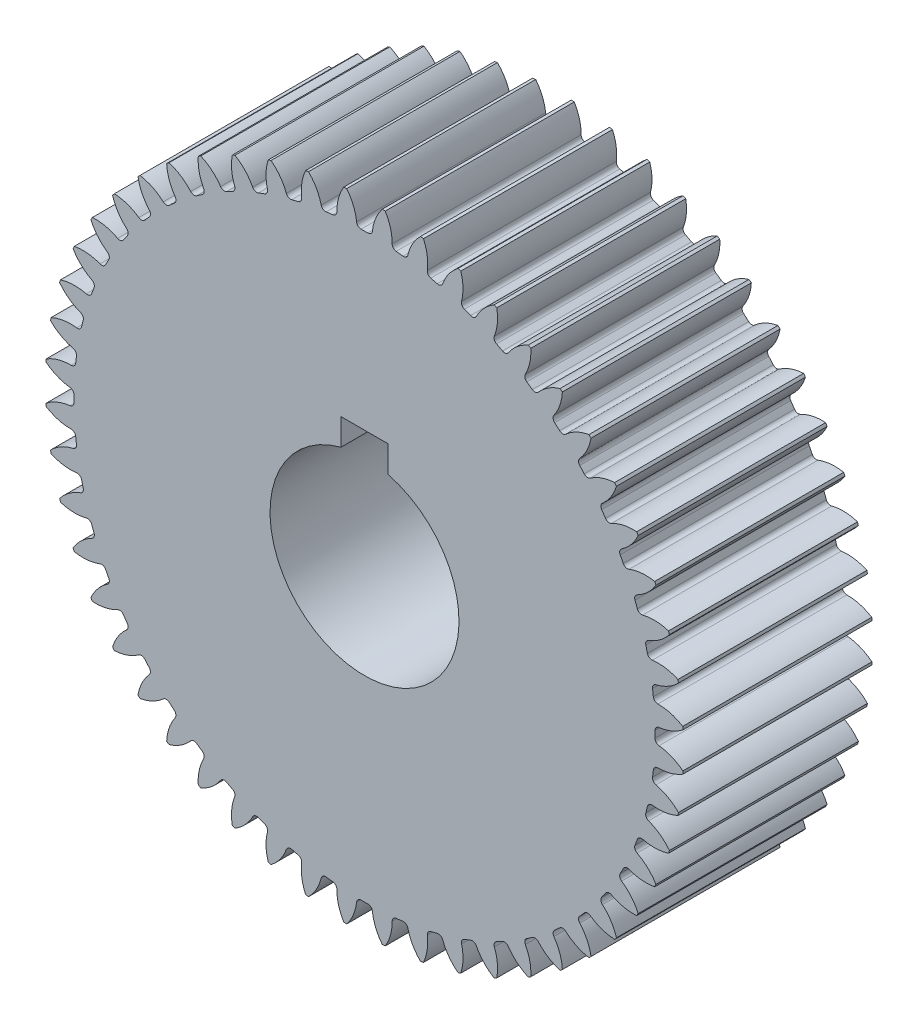
from build123d import *

# Parameters (mm, degrees)
SKETCH1_R                = 33.75
SKETCH1_R_2              = 10
BOSS_EXTRUDE2_DEPTH      = 20
CUT_EXTRUDE1_DEPTH       = 52.750603861
FILLET1_R                = 0.475
CIRPATTERN1_COUNT        = 52
FILLET1_OF_CIRPATTERN1_R = 0.475
CUT_EXTRUDE2_DEPTH       = 52.682144843


with BuildPart() as part:
    # Sketch1 → Boss-Extrude2 (new body)
    with BuildSketch(Plane(origin=(0, 0, 0), x_dir=(0, 1, 0), z_dir=(0, 0, 1))):
        Circle(SKETCH1_R)
        Circle(SKETCH1_R_2, mode=Mode.SUBTRACT)
    extrude(amount=BOSS_EXTRUDE2_DEPTH)

    # Sketch2 → Cut-Extrude1 (cut, through all)
    with BuildSketch(Plane.XY.offset(20)):
        with BuildLine():
            ThreePointArc((-0.804970601, 30.739461972), (-1.102417477, 32.306155708), (-1.881611272, 33.697507905))
            ThreePointArc((-1.881611272, 33.697507905), (0, 33.75), (1.881611272, 33.697507905))
            ThreePointArc((1.881611272, 33.697507905), (1.102417477, 32.306155708), (0.804970601, 30.739461972))
            ThreePointArc((0.804970601, 30.739461972), (0, 30.75), (-0.804970601, 30.739461972))
        make_face()
    cut_extrude1 = extrude(amount=-CUT_EXTRUDE1_DEPTH, mode=Mode.SUBTRACT)

    # Fillet1
    fillet1_edges = [part.edges().sort_by_distance(p)[0] for p in [
        (-0.804970601, 30.739461972, 10),
        (0.804970601, 30.739461972, 10),
    ]]
    fillet(fillet1_edges, radius=FILLET1_R)

    # CirPattern1: Cut-Extrude1 ×52 about axis
    cirpattern1_axis = Axis((0, 0, 20), (0, 0, 1))
    for i in range(1, CIRPATTERN1_COUNT):
        add(cut_extrude1.rotate(cirpattern1_axis, i * 360 / CIRPATTERN1_COUNT), mode=Mode.SUBTRACT)

    # Fillet1 of CirPattern1
    fillet1_of_cirpattern1_edges = [part.edges().sort_by_distance(p)[0] for p in [
        (-4.504334158, 30.418308201, 10),
        (-2.90613124, 30.612365169, 10),
        (-8.13801438, 29.653587, 10),
        (-6.574855144, 30.038871148, 10),
        (-11.653024027, 28.456449726, 10),
        (-10.147702854, 29.027342744, 10),
        (-14.998106343, 26.844353338, 10),
        (-13.572574206, 27.592530319, 10),
        (-18.124482497, 24.840805829, 10),
        (-16.799526863, 25.75535667, 10),
        (-20.986562882, 22.475023435, 10),
        (-19.781504589, 23.542611924, 10),
        (-23.542611924, 19.781504589, 10),
        (-22.475023435, 20.986562882, 10),
        (-25.75535667, 16.799526863, 10),
        (-24.840805829, 18.124482497, 10),
        (-27.592530319, 13.572574206, 10),
        (-26.844353338, 14.998106343, 10),
        (-29.027342744, 10.147702854, 10),
        (-28.456449726, 11.653024027, 10),
        (-30.038871148, 6.574855144, 10),
        (-29.653587, 8.13801438, 10),
        (-30.612365169, 2.90613124, 10),
        (-30.418308201, 4.504334158, 10),
        (-30.739461972, -0.804970601, 10),
        (-30.739461972, 0.804970601, 10),
        (-30.418308201, -4.504334158, 10),
        (-30.612365169, -2.90613124, 10),
        (-29.653587, -8.13801438, 10),
        (-30.038871148, -6.574855144, 10),
        (-28.456449726, -11.653024027, 10),
        (-29.027342744, -10.147702854, 10),
        (-26.844353338, -14.998106343, 10),
        (-27.592530319, -13.572574206, 10),
        (-24.840805829, -18.124482497, 10),
        (-25.75535667, -16.799526863, 10),
        (-22.475023435, -20.986562882, 10),
        (-23.542611924, -19.781504589, 10),
        (-19.781504589, -23.542611924, 10),
        (-20.986562882, -22.475023435, 10),
        (-16.799526863, -25.75535667, 10),
        (-18.124482497, -24.840805829, 10),
        (-13.572574206, -27.592530319, 10),
        (-14.998106343, -26.844353338, 10),
        (-10.147702854, -29.027342744, 10),
        (-11.653024027, -28.456449726, 10),
        (-6.574855144, -30.038871148, 10),
        (-8.13801438, -29.653587, 10),
        (-2.90613124, -30.612365169, 10),
        (-4.504334158, -30.418308201, 10),
        (0.804970601, -30.739461972, 10),
        (-0.804970601, -30.739461972, 10),
        (4.504334158, -30.418308201, 10),
        (2.90613124, -30.612365169, 10),
        (8.13801438, -29.653587, 10),
        (6.574855144, -30.038871148, 10),
        (11.653024027, -28.456449726, 10),
        (10.147702854, -29.027342744, 10),
        (14.998106343, -26.844353338, 10),
        (13.572574206, -27.592530319, 10),
        (18.124482497, -24.840805829, 10),
        (16.799526863, -25.75535667, 10),
        (20.986562882, -22.475023435, 10),
        (19.781504589, -23.542611924, 10),
        (23.542611924, -19.781504589, 10),
        (22.475023435, -20.986562882, 10),
        (25.75535667, -16.799526863, 10),
        (24.840805829, -18.124482497, 10),
        (27.592530319, -13.572574206, 10),
        (26.844353338, -14.998106343, 10),
        (29.027342744, -10.147702854, 10),
        (28.456449726, -11.653024027, 10),
        (30.038871148, -6.574855144, 10),
        (29.653587, -8.13801438, 10),
        (30.612365169, -2.90613124, 10),
        (30.418308201, -4.504334158, 10),
        (30.739461972, 0.804970601, 10),
        (30.739461972, -0.804970601, 10),
        (30.418308201, 4.504334158, 10),
        (30.612365169, 2.90613124, 10),
        (29.653587, 8.13801438, 10),
        (30.038871148, 6.574855144, 10),
        (28.456449726, 11.653024027, 10),
        (29.027342744, 10.147702854, 10),
        (26.844353338, 14.998106343, 10),
        (27.592530319, 13.572574206, 10),
        (24.840805829, 18.124482497, 10),
        (25.75535667, 16.799526863, 10),
        (22.475023435, 20.986562882, 10),
        (23.542611924, 19.781504589, 10),
        (19.781504589, 23.542611924, 10),
        (20.986562882, 22.475023435, 10),
        (16.799526863, 25.75535667, 10),
        (18.124482497, 24.840805829, 10),
        (13.572574206, 27.592530319, 10),
        (14.998106343, 26.844353338, 10),
        (10.147702854, 29.027342744, 10),
        (11.653024027, 28.456449726, 10),
        (6.574855144, 30.038871148, 10),
        (8.13801438, 29.653587, 10),
        (2.90613124, 30.612365169, 10),
        (4.504334158, 30.418308201, 10),
    ]]
    fillet(fillet1_of_cirpattern1_edges, radius=FILLET1_OF_CIRPATTERN1_R)

    # Sketch3 → Cut-Extrude2 (cut, through all)
    with BuildSketch(Plane.XY.offset(20)):
        with BuildLine():
            Line((-2.5, 12.5), (2.5, 12.5))
            Line((2.5, 12.5), (2.5, 9.682458366))
            ThreePointArc((2.5, 9.682458366), (0, 10), (-2.5, 9.682458366))
            Line((-2.5, 9.682458366), (-2.5, 12.5))
        make_face()
    extrude(amount=-CUT_EXTRUDE2_DEPTH, mode=Mode.SUBTRACT)


solid = part.part
